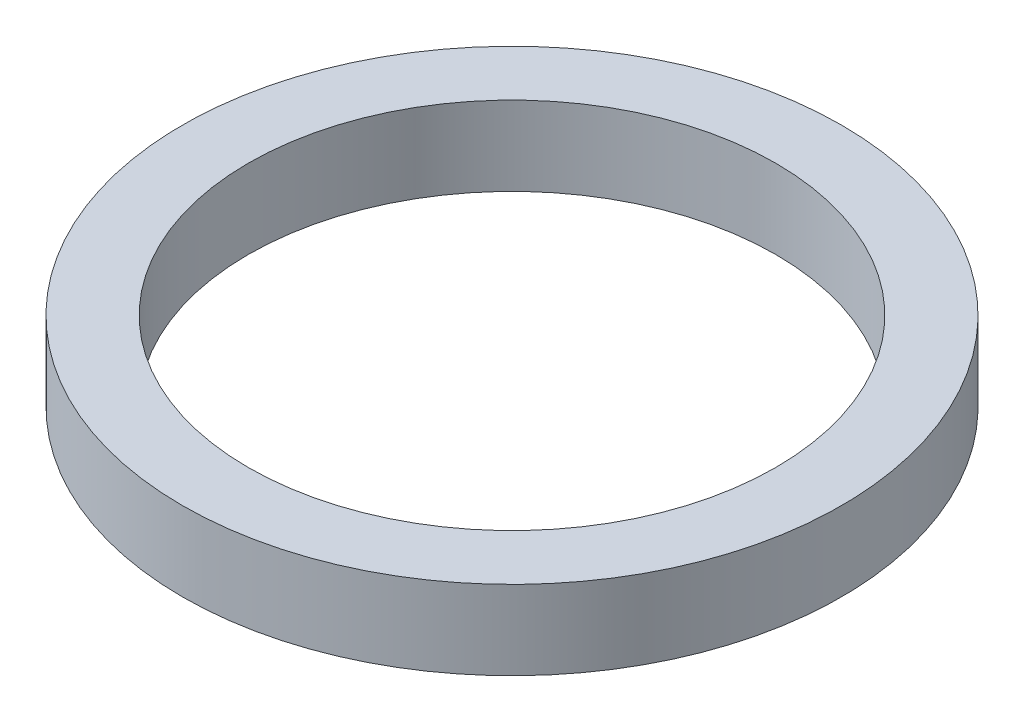
from build123d import *

# Parameters (mm, degrees)
SKETCH1_R           = 37.5
BOSS_EXTRUDE1_DEPTH = 9
SKETCH2_R           = 30
CUT_EXTRUDE1_DEPTH  = 54.791263231


with BuildPart() as part:
    # Sketch1 → Boss-Extrude1 (new body)
    with BuildSketch(Plane(origin=(0, 0, 0), x_dir=(1, 0, 0), z_dir=(0, 1, 0))):
        Circle(SKETCH1_R)
    extrude(amount=BOSS_EXTRUDE1_DEPTH)

    # Sketch2 → Cut-Extrude1 (cut, through all)
    with BuildSketch(Plane(origin=(0, 0, 0), x_dir=(1, 0, 0), z_dir=(0, 1, 0))):
        Circle(SKETCH2_R)
    extrude(amount=CUT_EXTRUDE1_DEPTH, mode=Mode.SUBTRACT)


solid = part.part
